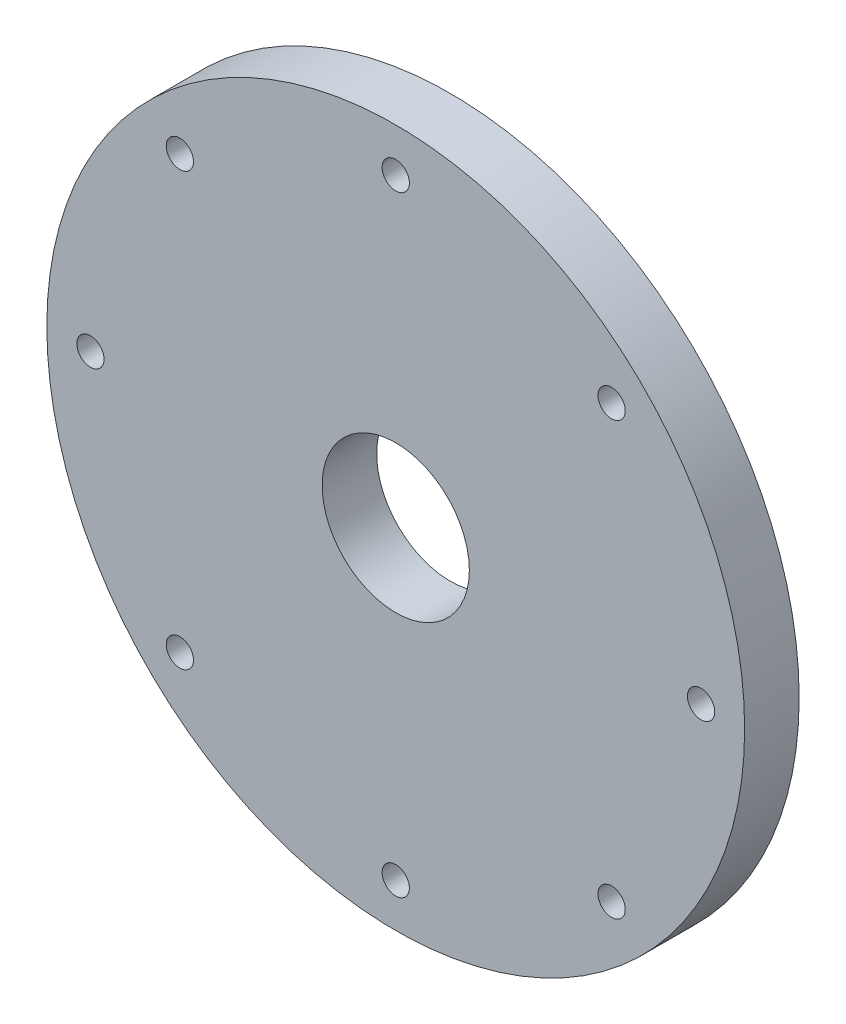
from build123d import *

# Parameters (mm, degrees)
CROQUIS1_R              = 32
SALIENTE_EXTRUIR1_DEPTH = 5
CROQUIS2_R              = 1.25
CORTAR_EXTRUIR1_DEPTH   = 46.530209751
CROQUIS3_R              = 6.75
CORTAR_EXTRUIR2_DEPTH   = 10


with BuildPart() as part:
    # Croquis1 → Saliente-Extruir1 (new body)
    with BuildSketch(Plane.XY):
        Circle(CROQUIS1_R)
    extrude(amount=SALIENTE_EXTRUIR1_DEPTH)

    # Croquis2 → Cortar-Extruir1 (cut, through all)
    with BuildSketch(Plane.XY.offset(5)):
        with Locations((0, 28)):
            Circle(CROQUIS2_R)
        with Locations((19.798989873, 19.798989873)):
            Circle(CROQUIS2_R)
        with Locations((28, 0)):
            Circle(CROQUIS2_R)
        with Locations((19.798989873, -19.798989873)):
            Circle(CROQUIS2_R)
        with Locations((0, -28)):
            Circle(CROQUIS2_R)
        with Locations((-19.798989873, -19.798989873)):
            Circle(CROQUIS2_R)
        with Locations((-28, 0)):
            Circle(CROQUIS2_R)
        with Locations((-19.798989873, 19.798989873)):
            Circle(CROQUIS2_R)
    extrude(amount=-CORTAR_EXTRUIR1_DEPTH, mode=Mode.SUBTRACT)

    # Croquis3 → Cortar-Extruir2 (cut)
    with BuildSketch(Plane.XY.offset(5)):
        Circle(CROQUIS3_R)
    extrude(amount=-CORTAR_EXTRUIR2_DEPTH, mode=Mode.SUBTRACT)


solid = part.part
